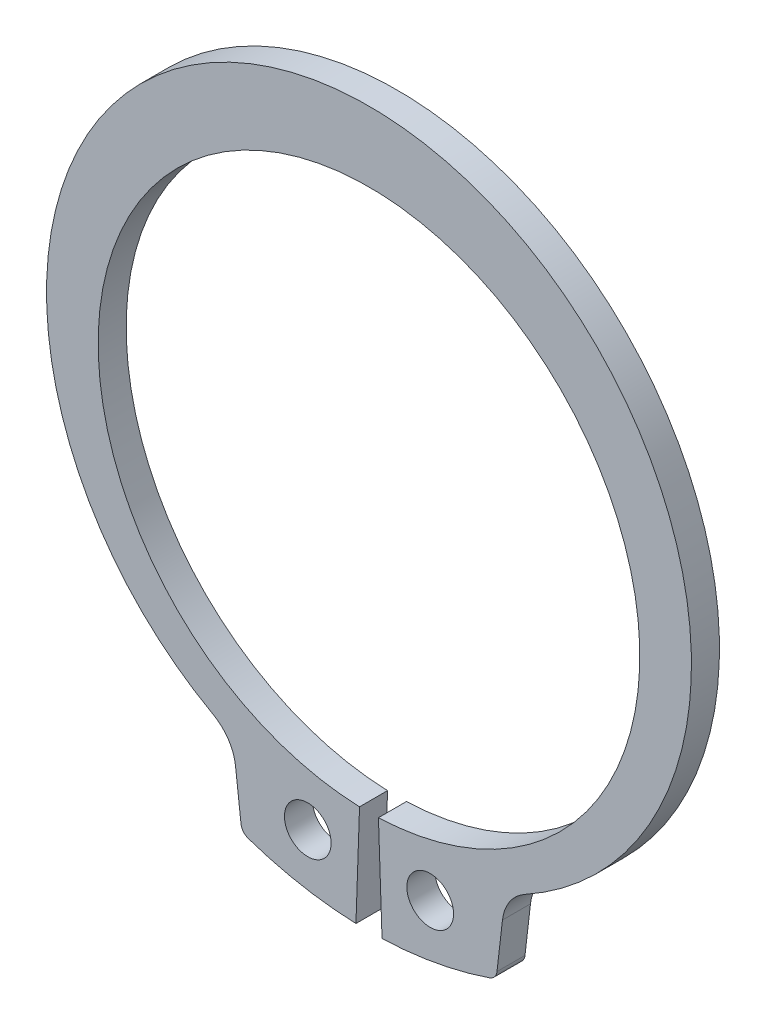
from build123d import *

# Parameters (mm, degrees)
SKETCH4_R           = 1
BOSS_EXTRUDE1_DEPTH = 0.6
FILLET1_R           = 1.882609209
FILLET2_R           = 0.470652302


with BuildPart() as part:
    # Sketch4 → Boss-Extrude1 (new, symmetric)
    with BuildSketch(Plane.XY):
        with BuildLine():
            Line((-5.447822247, -15.054348693), (-5.831813432, -11.730300597))
            ThreePointArc((-5.831813432, -11.730300597), (-13.484201658, 3.775587293), (0, 14.6))
            Line((0, 14.6), (0, 11.6))
            ThreePointArc((0, 11.6), (-11.598233264, 0.202447915), (-0.404834162, -11.592933593))
            Line((-0.404834162, -11.592933593), (-0.558732312, -16))
            ThreePointArc((-0.558732312, -16), (-3.040269481, -15.71842687), (-5.447822247, -15.054348693))
        make_face()
        with Locations((-2.621561059, -13.553672151)):
            Circle(SKETCH4_R, mode=Mode.SUBTRACT)
    extrude(amount=BOSS_EXTRUDE1_DEPTH, both=True)

    # Fillet1
    fillet1_edges = [part.edges().sort_by_distance(p)[0] for p in [
        (-5.831813432, -11.730300597, 0),
    ]]
    fillet(fillet1_edges, radius=FILLET1_R)

    # Fillet2
    fillet2_edges = [part.edges().sort_by_distance(p)[0] for p in [
        (-5.447822247, -15.054348693, 0),
    ]]
    fillet(fillet2_edges, radius=FILLET2_R)

    # Mirror1: part across plane


with BuildPart() as part_1:
    add(part.part)
    add(part.part.mirror(Plane(origin=(0, 14.6, 0.6), x_dir=(0, 0, 1), z_dir=(-1, 0, 0))))


solid = part_1.part
